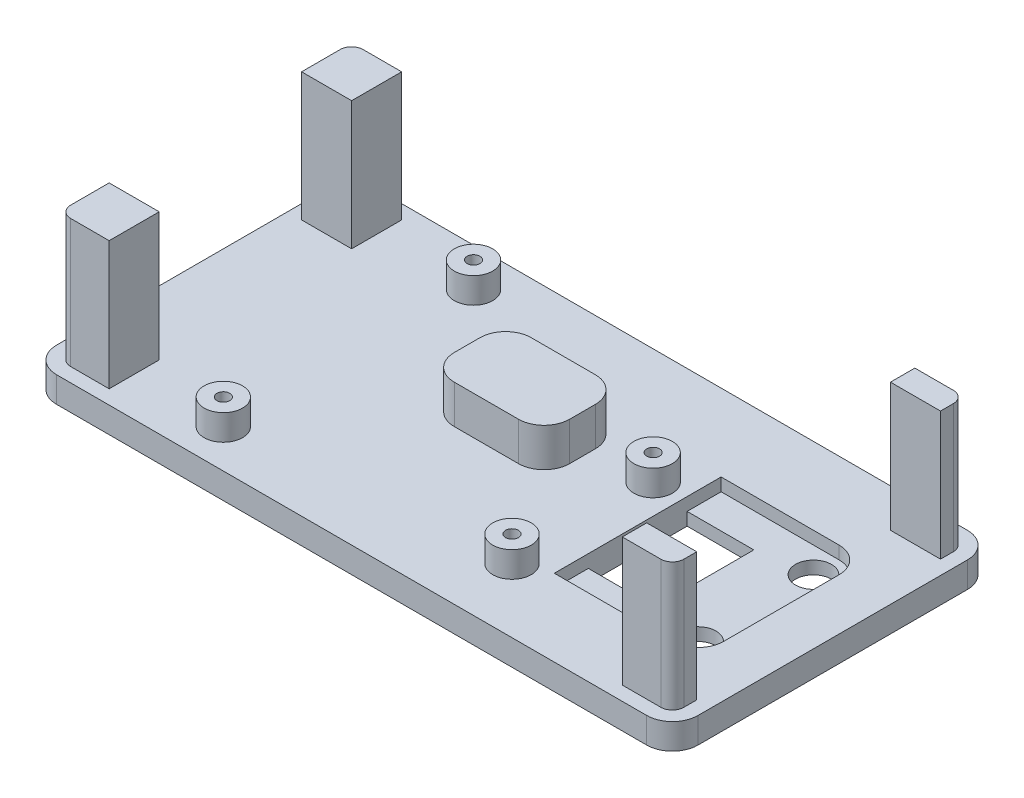
from build123d import *

# Parameters (mm, degrees)
SKETCH1_W            = 127
SKETCH1_H            = 63.5
BOSS_EXTRUDE1_DEPTH  = 5.08
SKETCH2_W            = 9.906
SKETCH2_H            = 9.906
SKETCH2_H_2          = 4.826
BOSS_EXTRUDE3_DEPTH  = 25.4
FILLET3_R            = 2.286
FILLET4_R            = 5.08
CUT_EXTRUDE8_REACH   = 146.244
SKETCH13_R           = 3.556
SKETCH13_W           = 13.208
SKETCH13_H           = 19.558
SKETCH14_W           = 13.208
SKETCH14_H           = 29.718
CUT_EXTRUDE9_DEPTH   = 2.54
SKETCH19_R           = 5.08
CUT_EXTRUDE12_DEPTH  = 2.54
SKETCH4_R            = 3.81
SKETCH4_R_2          = 1.27
BOSS_EXTRUDE13_DEPTH = 5.08
SKETCH7_W            = 22.86
SKETCH7_H            = 15.24
BOSS_EXTRUDE14_DEPTH = 7.62
FILLET5_R            = 5.08
CUT_EXTRUDE13_DEPTH  = 2.54


with BuildPart() as part:
    # Sketch1 → Boss-Extrude1 (new body)
    with BuildSketch(Plane(origin=(0, 0, 0), x_dir=(1, 0, 0), z_dir=(0, 1, 0))):
        with Locations((63.5, 31.75)):
            Rectangle(SKETCH1_W, SKETCH1_H)
    extrude(amount=BOSS_EXTRUDE1_DEPTH)

    # Sketch2 → Boss-Extrude3 (add)
    with BuildSketch(Plane(origin=(0, 5.08, 0), x_dir=(1, 0, 0), z_dir=(0, 1, 0))):
        with Locations((7.747, 7.747)):
            Rectangle(SKETCH2_W, SKETCH2_H)
        with Locations((7.747, 55.753)):
            Rectangle(SKETCH2_W, SKETCH2_H)
        with Locations((119.253, 5.207)):
            Rectangle(SKETCH2_W, SKETCH2_H_2)
        with Locations((119.253, 58.293)):
            Rectangle(SKETCH2_W, SKETCH2_H_2)
    extrude(amount=BOSS_EXTRUDE3_DEPTH)

    # Fillet3
    fillet3_edges = [part.edges().sort_by_distance(p)[0] for p in [
        (124.206, 17.78, -60.706),
        (124.206, 17.78, -2.794),
        (2.794, 17.78, -2.794),
        (2.794, 17.78, -60.706),
    ]]
    fillet(fillet3_edges, radius=FILLET3_R)

    # Fillet4
    fillet4_edges = [part.edges().sort_by_distance(p)[0] for p in [
        (0, 2.54, -63.5),
        (127, 2.54, -63.5),
        (127, 2.54, 0),
        (0, 2.54, 0),
    ]]
    fillet(fillet4_edges, radius=FILLET4_R)

    # Sketch13 → Cut-Extrude8 (cut, up to next)
    with BuildSketch(Plane(origin=(0, 5.08, 0), x_dir=(1, 0, 0), z_dir=(0, 1, 0)), mode=Mode.PRIVATE) as cut_extrude8_sk1:
        with Locations((111.76, 43.18)):
            Circle(SKETCH13_R)
    cut_extrude8_tool1 = extrude(cut_extrude8_sk1.sketch, amount=-CUT_EXTRUDE8_REACH, mode=Mode.PRIVATE) & part.part
    # Sketch13 → Cut-Extrude8 (cut, up to next)
    with BuildSketch(Plane(origin=(0, 5.08, 0), x_dir=(1, 0, 0), z_dir=(0, 1, 0)), mode=Mode.PRIVATE) as cut_extrude8_sk2:
        with Locations((111.76, 20.32)):
            Circle(SKETCH13_R)
    cut_extrude8_tool2 = extrude(cut_extrude8_sk2.sketch, amount=-CUT_EXTRUDE8_REACH, mode=Mode.PRIVATE) & part.part
    # Sketch13 → Cut-Extrude8 (cut, up to next)
    with BuildSketch(Plane(origin=(0, 5.08, 0), x_dir=(1, 0, 0), z_dir=(0, 1, 0)), mode=Mode.PRIVATE) as cut_extrude8_sk3:
        with Locations((94.996, 31.75)):
            Rectangle(SKETCH13_W, SKETCH13_H)
    cut_extrude8_tool3 = extrude(cut_extrude8_sk3.sketch, amount=-CUT_EXTRUDE8_REACH, mode=Mode.PRIVATE) & part.part
    add(cut_extrude8_tool1.solids().sort_by_distance((111.76, 5.08, -43.18))[0], mode=Mode.SUBTRACT)
    add(cut_extrude8_tool2.solids().sort_by_distance((111.76, 5.08, -20.32))[0], mode=Mode.SUBTRACT)
    add(cut_extrude8_tool3.solids().sort_by_distance((94.996, 5.08, -31.75))[0], mode=Mode.SUBTRACT)

    # Sketch14 → Cut-Extrude9 (cut)
    with BuildSketch(Plane(origin=(0, 5.08, 0), x_dir=(1, 0, 0), z_dir=(0, 1, 0))):
        with Locations((94.996, 31.75)):
            Rectangle(SKETCH14_W, SKETCH14_H)
    extrude(amount=-CUT_EXTRUDE9_DEPTH, mode=Mode.SUBTRACT)

    # Sketch19 → Cut-Extrude12 (cut)
    with BuildSketch(Plane(origin=(0, 5.08, 0), x_dir=(1, 0, 0), z_dir=(0, 1, 0))):
        with Locations((111.76, 43.18)):
            Circle(SKETCH19_R)
        with Locations((111.76, 20.32)):
            Circle(SKETCH19_R)
    extrude(amount=-CUT_EXTRUDE12_DEPTH, mode=Mode.SUBTRACT)

    # Sketch4 → Boss-Extrude13 (add)
    # profile 1 of 4: a face of its own
    with BuildSketch(Plane(origin=(0, 5.08, 0), x_dir=(1, 0, 0), z_dir=(0, 1, 0))):
        with Locations((31.75, 55.88)):
            Circle(SKETCH4_R)
        with Locations((31.75, 55.88)):
            Circle(SKETCH4_R_2, mode=Mode.SUBTRACT)
    # profile 2 of 4: a face of its own
    with BuildSketch(Plane(origin=(0, 5.08, 0), x_dir=(1, 0, 0), z_dir=(0, 1, 0))):
        with Locations((30.48, 7.62)):
            Circle(SKETCH4_R)
        with Locations((30.48, 7.62)):
            Circle(SKETCH4_R_2, mode=Mode.SUBTRACT)
    # profile 3 of 4: a face of its own
    with BuildSketch(Plane(origin=(0, 5.08, 0), x_dir=(1, 0, 0), z_dir=(0, 1, 0))):
        with Locations((82.55, 40.64)):
            Circle(SKETCH4_R)
        with Locations((82.55, 40.64)):
            Circle(SKETCH4_R_2, mode=Mode.SUBTRACT)
    # profile 4 of 4: a face of its own
    with BuildSketch(Plane(origin=(0, 5.08, 0), x_dir=(1, 0, 0), z_dir=(0, 1, 0))):
        with Locations((82.55, 12.7)):
            Circle(SKETCH4_R)
        with Locations((82.55, 12.7)):
            Circle(SKETCH4_R_2, mode=Mode.SUBTRACT)
    extrude(amount=BOSS_EXTRUDE13_DEPTH)

    # Sketch7 → Boss-Extrude14 (add)
    with BuildSketch(Plane(origin=(0, 5.08, 0), x_dir=(1, 0, 0), z_dir=(0, 1, 0))):
        with Locations((59.69, 38.1)):
            Rectangle(SKETCH7_W, SKETCH7_H)
    extrude(amount=BOSS_EXTRUDE14_DEPTH)

    # Fillet5
    fillet5_edges = [part.edges().sort_by_distance(p)[0] for p in [
        (48.26, 8.89, -45.72),
        (71.12, 8.89, -45.72),
        (71.12, 8.89, -30.48),
        (48.26, 8.89, -30.48),
    ]]
    fillet(fillet5_edges, radius=FILLET5_R)

    # Sketch21 → Cut-Extrude13 (cut)
    with BuildSketch(Plane(origin=(0, 5.08, 0), x_dir=(1, 0, 0), z_dir=(0, 1, 0))):
        with BuildLine():
            Line((111.76, 48.26), (88.392, 48.26))
            Line((88.392, 48.26), (88.392, 15.24))
            Line((88.392, 15.24), (111.76, 15.24))
            ThreePointArc((111.76, 15.24), (115.352102448, 16.727897552), (116.84, 20.32))
            Line((116.84, 20.32), (116.84, 43.18))
            ThreePointArc((116.84, 43.18), (115.352102448, 46.772102448), (111.76, 48.26))
        make_face()
    extrude(amount=-CUT_EXTRUDE13_DEPTH, mode=Mode.SUBTRACT)


solid = part.part
